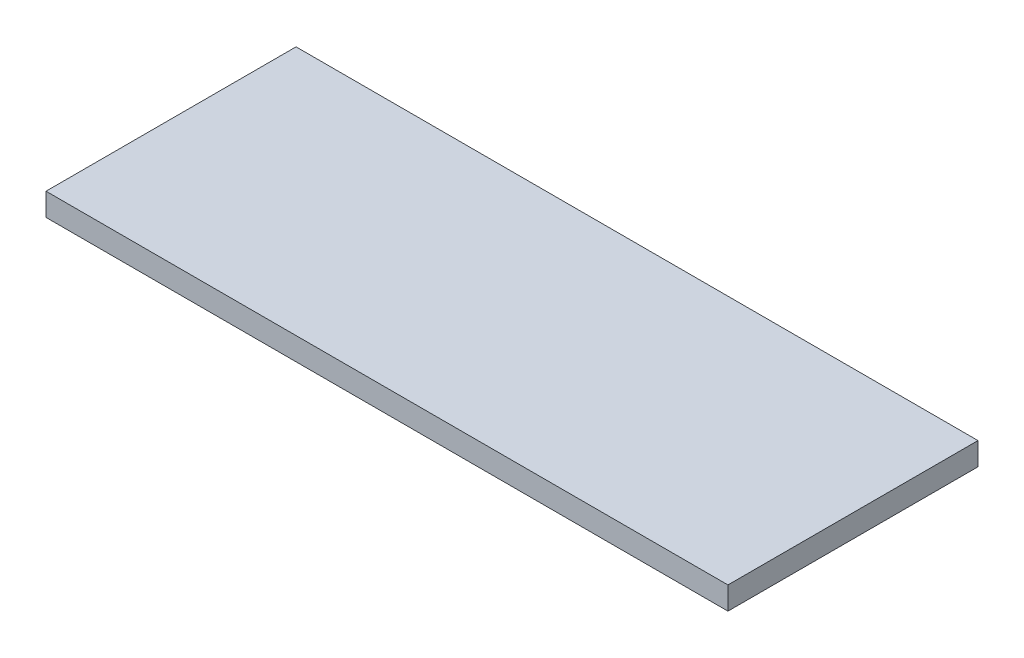
from build123d import *

# Parameters (mm, degrees)
SKETCH1_W           = 95.25
SKETCH1_H           = 34.925
BOSS_EXTRUDE1_DEPTH = 3.175


with BuildPart() as part:
    # Sketch1 → Boss-Extrude1 (new body)
    with BuildSketch(Plane(origin=(0, 0, 0), x_dir=(1, 0, 0), z_dir=(0, 1, 0))):
        Rectangle(SKETCH1_W, SKETCH1_H)
    extrude(amount=BOSS_EXTRUDE1_DEPTH)


solid = part.part
